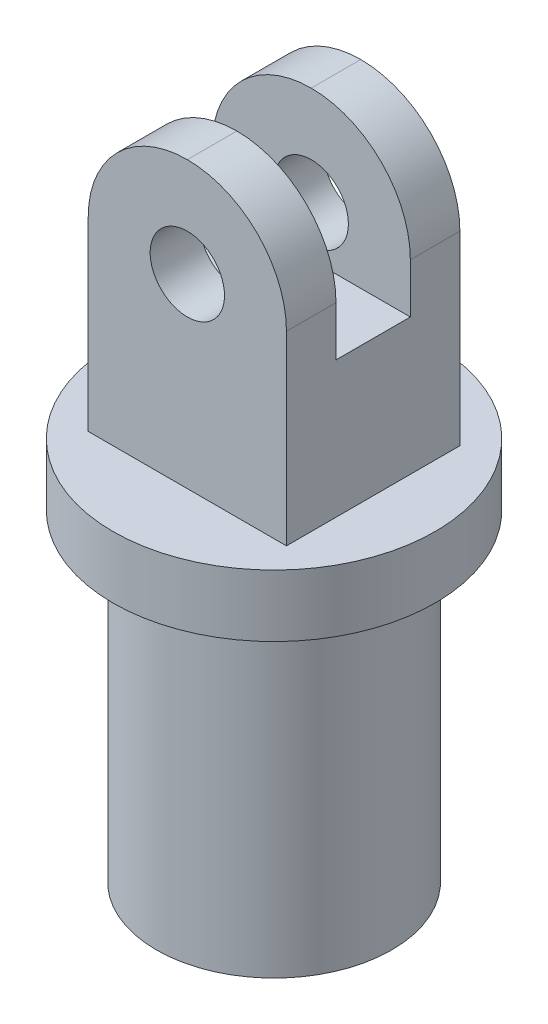
from build123d import *

# Parameters (mm, degrees)
SKETCH1_R           = 6.5
BOSS_EXTRUDE1_DEPTH = 2.5
SKETCH2_R           = 4.75
SKETCH2_R_2         = 3
BOSS_EXTRUDE2_DEPTH = 13
SKETCH3_W           = 8
SKETCH3_H           = 7
BOSS_EXTRUDE3_DEPTH = 11.5
FILLET1_R           = 4
SKETCH4_R           = 1.5
CUT_EXTRUDE1_DEPTH  = 13
SKETCH5_W           = 3
SKETCH5_H           = 10.207029109
CUT_EXTRUDE2_DEPTH  = 13


with BuildPart() as part:
    # Sketch1 → Boss-Extrude1 (new body)
    with BuildSketch(Plane(origin=(0, 0, 0), x_dir=(1, 0, 0), z_dir=(0, 1, 0))):
        with Locations(Location((0, 0, 0), (0, 0, 270))):
            Circle(SKETCH1_R)
    extrude(amount=BOSS_EXTRUDE1_DEPTH)

    # Sketch2 → Boss-Extrude2 (add)
    with BuildSketch(Plane.XZ):
        with Locations(Location((0, 0, 0), (0, 0, 90))):
            Circle(SKETCH2_R)
        with Locations(Location((0, 0, 0), (0, 0, 90))):
            Circle(SKETCH2_R_2, mode=Mode.SUBTRACT)
    extrude(amount=BOSS_EXTRUDE2_DEPTH)

    # Sketch3 → Boss-Extrude3 (add)
    with BuildSketch(Plane(origin=(0, 2.5, 0), x_dir=(1, 0, 0), z_dir=(0, 1, 0))):
        Rectangle(SKETCH3_W, SKETCH3_H)
    extrude(amount=BOSS_EXTRUDE3_DEPTH)

    # Fillet1
    fillet1_edges = [part.edges().sort_by_distance(p)[0] for p in [
        (4, 14, 0),
        (-4, 14, 0),
    ]]
    fillet(fillet1_edges, radius=FILLET1_R - 0.0001)  # a hair under: the kernel refuses the full size

    # Sketch4 → Cut-Extrude1 (cut)
    with BuildSketch(Plane.XY.offset(3.5)):
        with Locations((0, 10)):
            Circle(SKETCH4_R)
    extrude(amount=-CUT_EXTRUDE1_DEPTH, mode=Mode.SUBTRACT)

    # Sketch5 → Cut-Extrude2 (cut)
    with BuildSketch(Plane.ZY.offset(4)):
        with Locations((0, 13.103514555)):
            Rectangle(SKETCH5_W, SKETCH5_H)
    extrude(amount=-CUT_EXTRUDE2_DEPTH, mode=Mode.SUBTRACT)


solid = part.part
